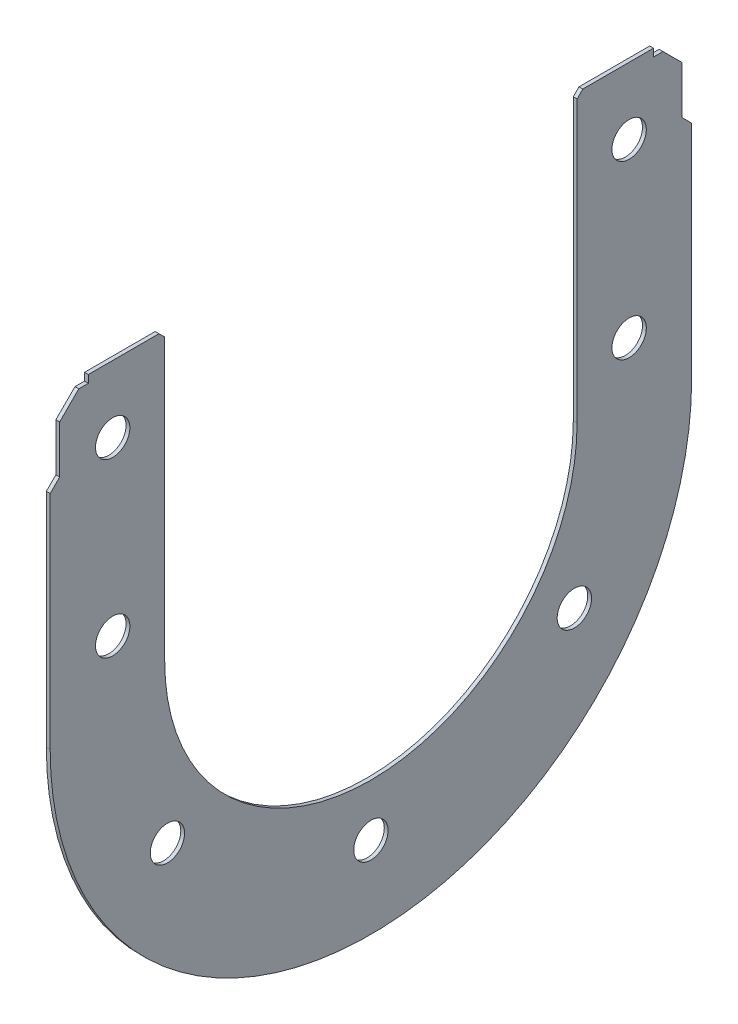
from build123d import *

# Parameters (mm, degrees)
SM_START                 = -1
SM_BASE_FLANGE_1_DEPTH   = 2
SKETCH_6_R               = 9
SKETCH_6_R_2             = 68.5
CUT_EXTRUDE_1_DEPTH      = 245.769279118
CUT_EXTRUDE_2_DEPTH      = 245.763150821
CUT_EXTRUDE_2_DEPTH_BACK = 245.763150821
CHAMFER_3_SIZE           = 10
CHAMFER_4_SIZE           = 3


# Read off the part's stored shape, not the designer's step: Базовая кромка1
with BuildPart() as part:
    # Базовая кромка1 outline → Базовая кромка1 (new body)
    with BuildSketch(Plane(origin=(0, 0, 0), x_dir=(0, 0, -1), z_dir=(1, 0, 0)).offset(SM_START)):
        with BuildLine():
            ThreePointArc((108, 0), (0, -108), (-108, 0))
            Line((-108, 0), (-108, 150))
            Line((-108, 150), (-148, 150))
            Line((-148, 150), (-148, 146))
            Line((-148, 146), (-168, 146))
            Line((-168, 146), (-168, -10))
            ThreePointArc((-168, -10), (0, -178), (168, -10))
            Line((168, -10), (168, 146))
            Line((168, 146), (148, 146))
            Line((148, 146), (148, 150))
            Line((148, 150), (108, 150))
            Line((108, 150), (108, 0))
        make_face()
    extrude(amount=SM_BASE_FLANGE_1_DEPTH)

    # Эскиз6 → Вырез-Вытянуть1 (cut, through all)
    with BuildSketch(Plane(origin=(1, 0, 0), x_dir=(0, 0, -1), z_dir=(1, 0, 0))):
        with Locations((-135.25, 115)):
            Circle(SKETCH_6_R)
        with Locations((-106.578454425, -83.268214538)):
            Circle(SKETCH_6_R)
        with Locations((0, -135.25)):
            Circle(SKETCH_6_R)
        with Locations((106.578454425, -83.268214538)):
            Circle(SKETCH_6_R)
        with Locations((135.25, 115)):
            Circle(SKETCH_6_R)
        Circle(SKETCH_6_R_2)
        with Locations((-135.25, 25)):
            Circle(SKETCH_6_R)
        with Locations((135.25, 25)):
            Circle(SKETCH_6_R)
    extrude(amount=-CUT_EXTRUDE_1_DEPTH, mode=Mode.SUBTRACT)

    # Эскиз7 → Вырез-Вытянуть2 (cut, two sides: drawn at the far end of the back side and taken through both)
    with BuildSketch(Plane(origin=(0, 0, 0), x_dir=(0, 0, -1), z_dir=(1, 0, 0)).offset(-CUT_EXTRUDE_2_DEPTH_BACK)):
        Polygon((-163, 111), (-168, 106), (-168, 111), (-168, 146), (-163, 146), align=None)
        Polygon((168, 146), (163, 146), (163, 111), (168, 106), (168, 111), align=None)
    extrude(amount=CUT_EXTRUDE_2_DEPTH + CUT_EXTRUDE_2_DEPTH_BACK, mode=Mode.SUBTRACT)

    # Фаска3
    chamfer_3_edges = [part.edges().sort_by_distance(p)[0] for p in [
        (0, 146, 163),
        (0, 146, -163),
    ]]
    chamfer(chamfer_3_edges, length=CHAMFER_3_SIZE)

    # Фаска4
    chamfer_4_edges = [part.edges().sort_by_distance(p)[0] for p in [
        (0, 150, -108),
        (0, 150, 108),
    ]]
    chamfer(chamfer_4_edges, length=CHAMFER_4_SIZE)


solid = part.part
